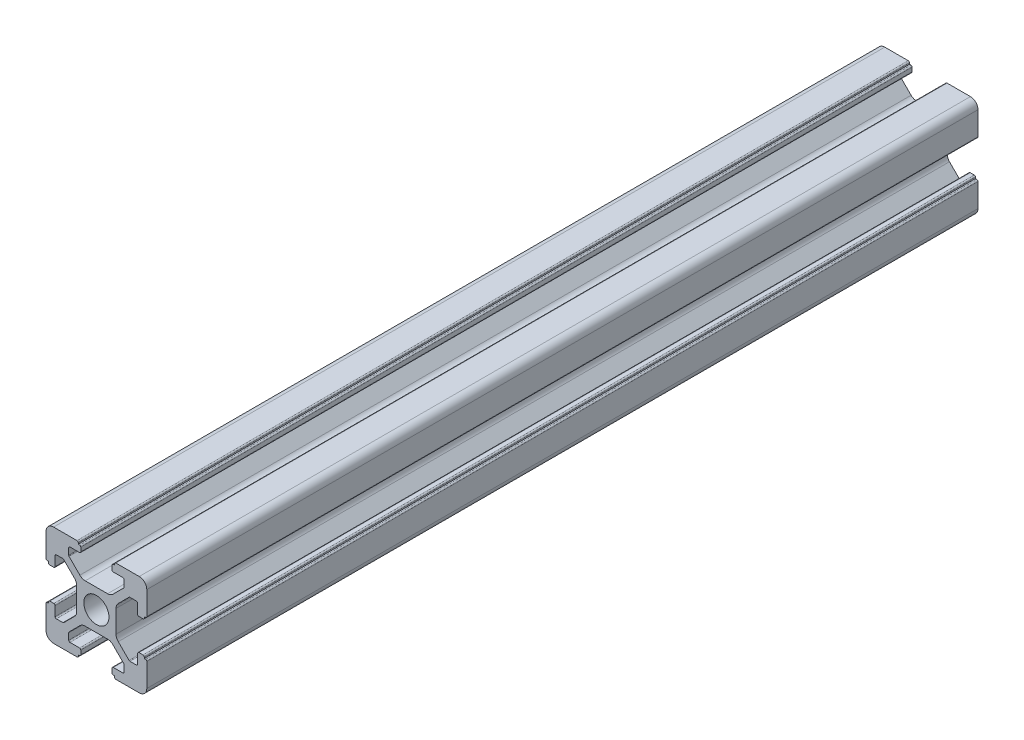
from build123d import *

# Parameters (mm, degrees)
SKETCH_1_R      = 2.5
EXTRUDE_1_DEPTH = 165


with BuildPart() as part:
    # 草图1 → 凸台-拉伸1 (new body)
    with BuildSketch(Plane.XY):
        with BuildLine():
            ThreePointArc((-10.002261885, -8.502261885), (-9.562922057, -9.562922057), (-8.502261885, -10.002261885))
            Line((-8.502261885, -10.002261885), (-3.85, -10.002261885))
            ThreePointArc((-3.85, -10.002261885), (-3.673223305, -9.929038581), (-3.6, -9.752261885))
            Line((-3.6, -9.752261885), (-3.6, -9.502261885))
            Line((-3.6, -9.502261885), (-3.35, -9.502261885))
            ThreePointArc((-3.35, -9.502261885), (-3.173223305, -9.429038581), (-3.1, -9.252261885))
            Line((-3.1, -9.252261885), (-3.1, -8.45))
            ThreePointArc((-3.1, -8.45), (-3.173223305, -8.273223305), (-3.35, -8.2))
            Line((-3.35, -8.2), (-5.25, -8.2))
            ThreePointArc((-5.25, -8.2), (-5.426776695, -8.126776695), (-5.5, -7.95))
            Line((-5.5, -7.95), (-5.5, -6.664213562))
            ThreePointArc((-5.5, -6.664213562), (-5.480969883, -6.568542704), (-5.426776695, -6.487436867))
            Line((-5.426776695, -6.487436867), (-3.278679656, -4.339339828))
            ThreePointArc((-3.278679656, -4.339339828), (-2.792044633, -4.014180701), (-2.218019485, -3.9))
            Line((-2.218019485, -3.9), (2.218019485, -3.9))
            ThreePointArc((2.218019485, -3.9), (2.792044633, -4.014180701), (3.278679656, -4.339339828))
            Line((3.278679656, -4.339339828), (5.426776695, -6.487436867))
            ThreePointArc((5.426776695, -6.487436867), (5.480969883, -6.568542704), (5.5, -6.664213562))
            Line((5.5, -6.664213562), (5.5, -7.95))
            ThreePointArc((5.5, -7.95), (5.426776695, -8.126776695), (5.25, -8.2))
            Line((5.25, -8.2), (3.35, -8.2))
            ThreePointArc((3.35, -8.2), (3.173223305, -8.273223305), (3.1, -8.45))
            Line((3.1, -8.45), (3.1, -9.252261885))
            ThreePointArc((3.1, -9.252261885), (3.173223305, -9.429038581), (3.35, -9.502261885))
            Line((3.35, -9.502261885), (3.6, -9.502261885))
            Line((3.6, -9.502261885), (3.6, -9.752261885))
            ThreePointArc((3.6, -9.752261885), (3.673223305, -9.929038581), (3.85, -10.002261885))
            Line((3.85, -10.002261885), (8.502261885, -10.002261885))
            ThreePointArc((8.502261885, -10.002261885), (9.562922057, -9.562922057), (10.002261885, -8.502261885))
            Line((10.002261885, -8.502261885), (10.002261885, -3.85))
            ThreePointArc((10.002261885, -3.85), (9.929038581, -3.673223305), (9.752261885, -3.6))
            Line((9.752261885, -3.6), (9.502261885, -3.6))
            Line((9.502261885, -3.6), (9.502261885, -3.35))
            ThreePointArc((9.502261885, -3.35), (9.429038581, -3.173223305), (9.252261885, -3.1))
            Line((9.252261885, -3.1), (8.45, -3.1))
            ThreePointArc((8.45, -3.1), (8.273223305, -3.173223305), (8.2, -3.35))
            Line((8.2, -3.35), (8.2, -5.25))
            ThreePointArc((8.2, -5.25), (8.126776695, -5.426776695), (7.95, -5.5))
            Line((7.95, -5.5), (6.664213562, -5.5))
            ThreePointArc((6.664213562, -5.5), (6.568542704, -5.480969883), (6.487436867, -5.426776695))
            Line((6.487436867, -5.426776695), (4.339339828, -3.278679656))
            ThreePointArc((4.339339828, -3.278679656), (4.014180701, -2.792044633), (3.9, -2.218019485))
            Line((3.9, -2.218019485), (3.9, 2.218019485))
            ThreePointArc((3.9, 2.218019485), (4.014180701, 2.792044633), (4.339339828, 3.278679656))
            Line((4.339339828, 3.278679656), (6.487436867, 5.426776695))
            ThreePointArc((6.487436867, 5.426776695), (6.568542704, 5.480969883), (6.664213562, 5.5))
            Line((6.664213562, 5.5), (7.95, 5.5))
            ThreePointArc((7.95, 5.5), (8.126776695, 5.426776695), (8.2, 5.25))
            Line((8.2, 5.25), (8.2, 3.35))
            ThreePointArc((8.2, 3.35), (8.273223305, 3.173223305), (8.45, 3.1))
            Line((8.45, 3.1), (9.252261885, 3.1))
            ThreePointArc((9.252261885, 3.1), (9.429038581, 3.173223305), (9.502261885, 3.35))
            Line((9.502261885, 3.35), (9.502261885, 3.6))
            Line((9.502261885, 3.6), (9.752261885, 3.6))
            ThreePointArc((9.752261885, 3.6), (9.929038581, 3.673223305), (10.002261885, 3.85))
            Line((10.002261885, 3.85), (10.002261885, 8.502261885))
            ThreePointArc((10.002261885, 8.502261885), (9.562922057, 9.562922057), (8.502261885, 10.002261885))
            Line((8.502261885, 10.002261885), (3.85, 10.002261885))
            ThreePointArc((3.85, 10.002261885), (3.673223305, 9.929038581), (3.6, 9.752261885))
            Line((3.6, 9.752261885), (3.6, 9.502261885))
            Line((3.6, 9.502261885), (3.35, 9.502261885))
            ThreePointArc((3.35, 9.502261885), (3.173223305, 9.429038581), (3.1, 9.252261885))
            Line((3.1, 9.252261885), (3.1, 8.45))
            ThreePointArc((3.1, 8.45), (3.173223305, 8.273223305), (3.35, 8.2))
            Line((3.35, 8.2), (5.25, 8.2))
            ThreePointArc((5.25, 8.2), (5.426776695, 8.126776695), (5.5, 7.95))
            Line((5.5, 7.95), (5.5, 6.664213562))
            ThreePointArc((5.5, 6.664213562), (5.480969883, 6.568542704), (5.426776695, 6.487436867))
            Line((5.426776695, 6.487436867), (3.278679656, 4.339339828))
            ThreePointArc((3.278679656, 4.339339828), (2.792044633, 4.014180701), (2.218019485, 3.9))
            Line((2.218019485, 3.9), (-2.218019485, 3.9))
            ThreePointArc((-2.218019485, 3.9), (-2.792044633, 4.014180701), (-3.278679656, 4.339339828))
            Line((-3.278679656, 4.339339828), (-5.426776695, 6.487436867))
            ThreePointArc((-5.426776695, 6.487436867), (-5.480969883, 6.568542704), (-5.5, 6.664213562))
            Line((-5.5, 6.664213562), (-5.5, 7.95))
            ThreePointArc((-5.5, 7.95), (-5.426776695, 8.126776695), (-5.25, 8.2))
            Line((-5.25, 8.2), (-3.35, 8.2))
            ThreePointArc((-3.35, 8.2), (-3.173223305, 8.273223305), (-3.1, 8.45))
            Line((-3.1, 8.45), (-3.1, 9.252261885))
            ThreePointArc((-3.1, 9.252261885), (-3.173223305, 9.429038581), (-3.35, 9.502261885))
            Line((-3.35, 9.502261885), (-3.6, 9.502261885))
            Line((-3.6, 9.502261885), (-3.6, 9.752261885))
            ThreePointArc((-3.6, 9.752261885), (-3.673223305, 9.929038581), (-3.85, 10.002261885))
            Line((-3.85, 10.002261885), (-8.502261885, 10.002261885))
            ThreePointArc((-8.502261885, 10.002261885), (-9.562922057, 9.562922057), (-10.002261885, 8.502261885))
            Line((-10.002261885, 8.502261885), (-10.002261885, 3.85))
            ThreePointArc((-10.002261885, 3.85), (-9.929038581, 3.673223305), (-9.752261885, 3.6))
            Line((-9.752261885, 3.6), (-9.502261885, 3.6))
            Line((-9.502261885, 3.6), (-9.502261885, 3.35))
            ThreePointArc((-9.502261885, 3.35), (-9.429038581, 3.173223305), (-9.252261885, 3.1))
            Line((-9.252261885, 3.1), (-8.45, 3.1))
            ThreePointArc((-8.45, 3.1), (-8.273223305, 3.173223305), (-8.2, 3.35))
            Line((-8.2, 3.35), (-8.2, 5.25))
            ThreePointArc((-8.2, 5.25), (-8.126776695, 5.426776695), (-7.95, 5.5))
            Line((-7.95, 5.5), (-6.664213562, 5.5))
            ThreePointArc((-6.664213562, 5.5), (-6.568542704, 5.480969883), (-6.487436867, 5.426776695))
            Line((-6.487436867, 5.426776695), (-4.339339828, 3.278679656))
            ThreePointArc((-4.339339828, 3.278679656), (-4.014180701, 2.792044633), (-3.9, 2.218019485))
            Line((-3.9, 2.218019485), (-3.9, -2.218019485))
            ThreePointArc((-3.9, -2.218019485), (-4.014180701, -2.792044633), (-4.339339828, -3.278679656))
            Line((-4.339339828, -3.278679656), (-6.487436867, -5.426776695))
            ThreePointArc((-6.487436867, -5.426776695), (-6.568542704, -5.480969883), (-6.664213562, -5.5))
            Line((-6.664213562, -5.5), (-7.95, -5.5))
            ThreePointArc((-7.95, -5.5), (-8.126776695, -5.426776695), (-8.2, -5.25))
            Line((-8.2, -5.25), (-8.2, -3.35))
            ThreePointArc((-8.2, -3.35), (-8.273223305, -3.173223305), (-8.45, -3.1))
            Line((-8.45, -3.1), (-9.252261885, -3.1))
            ThreePointArc((-9.252261885, -3.1), (-9.429038581, -3.173223305), (-9.502261885, -3.35))
            Line((-9.502261885, -3.35), (-9.502261885, -3.6))
            Line((-9.502261885, -3.6), (-9.752261885, -3.6))
            ThreePointArc((-9.752261885, -3.6), (-9.929038581, -3.673223305), (-10.002261885, -3.85))
            Line((-10.002261885, -3.85), (-10.002261885, -8.502261885))
        make_face()
        Circle(SKETCH_1_R, mode=Mode.SUBTRACT)
    extrude(amount=EXTRUDE_1_DEPTH)


solid = part.part
